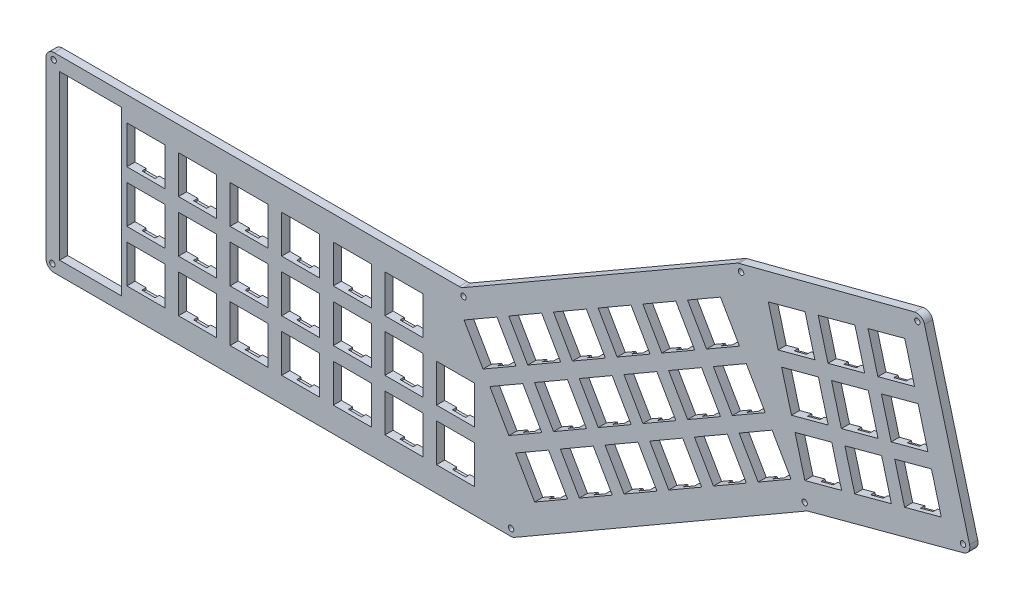
from build123d import *

# Parameters (mm, degrees)
ESQUISSE2_W                           = 14
ESQUISSE2_H                           = 14
BOSS_EXTRU_1_DEPTH                    = 3
ESQUISSE3_W                           = 4.83
ESQUISSE3_H                           = 0.7
ENL_V_MAT_EXTRU_1_DEPTH               = 1.57
R_P_TITION_LIN_AIRE1_COUNT            = 3
R_P_TITION_LIN_AIRE1_PITCH            = 19
R_P_TITION_LIN_AIRE2_COUNT            = 6
R_P_TITION_LIN_AIRE2_PITCH            = 19
R_P_TITION_LIN_AIRE2_COPY_1_SKETCH_W  = 4.83
R_P_TITION_LIN_AIRE2_COPY_1_SKETCH_H  = 0.7
R_P_TITION_LIN_AIRE2_COPY_1_DEPTH     = 1.57
R_P_TITION_LIN_AIRE2_COPY_2_SKETCH_W  = 4.83
R_P_TITION_LIN_AIRE2_COPY_2_SKETCH_H  = 0.7
R_P_TITION_LIN_AIRE2_COPY_2_DEPTH     = 1.57
R_P_TITION_LIN_AIRE2_COPY_3_SKETCH_W  = 4.83
R_P_TITION_LIN_AIRE2_COPY_3_SKETCH_H  = 0.7
R_P_TITION_LIN_AIRE2_COPY_3_DEPTH     = 1.57
R_P_TITION_LIN_AIRE2_COPY_4_SKETCH_W  = 4.83
R_P_TITION_LIN_AIRE2_COPY_4_SKETCH_H  = 0.7
R_P_TITION_LIN_AIRE2_COPY_4_DEPTH     = 1.57
R_P_TITION_LIN_AIRE2_COPY_5_SKETCH_W  = 4.83
R_P_TITION_LIN_AIRE2_COPY_5_SKETCH_H  = 0.7
R_P_TITION_LIN_AIRE2_COPY_5_DEPTH     = 1.57
R_P_TITION_LIN_AIRE2_COPY_6_SKETCH_W  = 4.83
R_P_TITION_LIN_AIRE2_COPY_6_SKETCH_H  = 0.7
R_P_TITION_LIN_AIRE2_COPY_6_DEPTH     = 1.57
R_P_TITION_LIN_AIRE2_COPY_7_SKETCH_W  = 4.83
R_P_TITION_LIN_AIRE2_COPY_7_SKETCH_H  = 0.7
R_P_TITION_LIN_AIRE2_COPY_7_DEPTH     = 1.57
R_P_TITION_LIN_AIRE2_COPY_8_SKETCH_W  = 4.83
R_P_TITION_LIN_AIRE2_COPY_8_SKETCH_H  = 0.7
R_P_TITION_LIN_AIRE2_COPY_8_DEPTH     = 1.57
R_P_TITION_LIN_AIRE2_COPY_9_SKETCH_W  = 4.83
R_P_TITION_LIN_AIRE2_COPY_9_SKETCH_H  = 0.7
R_P_TITION_LIN_AIRE2_COPY_9_DEPTH     = 1.57
R_P_TITION_LIN_AIRE2_COPY_10_SKETCH_W = 4.83
R_P_TITION_LIN_AIRE2_COPY_10_SKETCH_H = 0.7
R_P_TITION_LIN_AIRE2_COPY_10_DEPTH    = 1.57
ESQUISSE4_W                           = 4.83
ESQUISSE4_H                           = 0.7
ENL_V_MAT_EXTRU_2_DEPTH               = 1.57
R_P_TITION_LIN_AIRE3_COUNT            = 2
R_P_TITION_LIN_AIRE3_PITCH            = 19
ENL_V_MAT_EXTRU_3_DEPTH               = 1.57
R_P_TITION_LIN_AIRE4_COUNT            = 3
R_P_TITION_LIN_AIRE4_PITCH            = 19
R_P_TITION_LIN_AIRE5_COUNT            = 6
R_P_TITION_LIN_AIRE5_PITCH            = 19
R_P_TITION_LIN_AIRE5_COPY_1_DEPTH     = 1.57
R_P_TITION_LIN_AIRE5_COPY_2_DEPTH     = 1.57
R_P_TITION_LIN_AIRE5_COPY_3_DEPTH     = 1.57
R_P_TITION_LIN_AIRE5_COPY_4_DEPTH     = 1.57
R_P_TITION_LIN_AIRE5_COPY_5_DEPTH     = 1.57
R_P_TITION_LIN_AIRE5_COPY_6_DEPTH     = 1.57
R_P_TITION_LIN_AIRE5_COPY_7_DEPTH     = 1.57
R_P_TITION_LIN_AIRE5_COPY_8_DEPTH     = 1.57
R_P_TITION_LIN_AIRE5_COPY_9_DEPTH     = 1.57
R_P_TITION_LIN_AIRE5_COPY_10_DEPTH    = 1.57
ENL_V_MAT_EXTRU_4_DEPTH               = 1.57
R_P_TITION_LIN_AIRE6_COUNT            = 3
R_P_TITION_LIN_AIRE6_PITCH            = 19
R_P_TITION_LIN_AIRE7_COUNT            = 3
R_P_TITION_LIN_AIRE7_PITCH            = 19
R_P_TITION_LIN_AIRE7_COPY_1_DEPTH     = 1.57
R_P_TITION_LIN_AIRE7_COPY_2_DEPTH     = 1.57
R_P_TITION_LIN_AIRE7_COPY_3_DEPTH     = 1.57
R_P_TITION_LIN_AIRE7_COPY_4_DEPTH     = 1.57
CONG_2_R                              = 3
ESQUISSE10_R                          = 1
ENL_V_MAT_EXTRU_6_DEPTH               = 10


with BuildPart() as part:
    # Esquisse2 → Boss.-Extru.1 (new body)
    with BuildSketch(Plane.XY):
        Polygon((75.33141454, 71.077500491), (-26.464533767, 12.30154537), (-179.373873722, 12.291034855), (-179.373873722, -50.687645053), (-179.373873722, -57.858487698), (-7.520422715, -57.858487698), (100.854480283, 4.809102496), (161.383942986, 21.020985262), (143.246352653, 88.745859712), align=None)
        with Locations((-142.608757489, -41.687645053)):
            Rectangle(ESQUISSE2_W, ESQUISSE2_H, mode=Mode.SUBTRACT)
        with Locations((-123.608757489, -41.687645053)):
            Rectangle(ESQUISSE2_W, ESQUISSE2_H, mode=Mode.SUBTRACT)
        with Locations((-104.608757489, -41.687645053)):
            Rectangle(ESQUISSE2_W, ESQUISSE2_H, mode=Mode.SUBTRACT)
        Polygon((-151.608757489, 7.292943331), (-151.608757489, 5.312354947), (-151.608757489, -50.858487698), (-151.608757489, -52.858487698), (-174.373873722, -52.858487698), (-174.373873722, 7.291378528), align=None, mode=Mode.SUBTRACT)
        with Locations((-142.608757489, -22.687645053)):
            Rectangle(ESQUISSE2_W, ESQUISSE2_H, mode=Mode.SUBTRACT)
        with Locations((-123.608757489, -22.687645053)):
            Rectangle(ESQUISSE2_W, ESQUISSE2_H, mode=Mode.SUBTRACT)
        with Locations((-104.608757489, -22.687645053)):
            Rectangle(ESQUISSE2_W, ESQUISSE2_H, mode=Mode.SUBTRACT)
        with Locations((-85.608757489, -41.687645053)):
            Rectangle(ESQUISSE2_W, ESQUISSE2_H, mode=Mode.SUBTRACT)
        with Locations((-66.608757489, -41.687645053)):
            Rectangle(ESQUISSE2_W, ESQUISSE2_H, mode=Mode.SUBTRACT)
        with Locations((-47.608757489, -41.687645053)):
            Rectangle(ESQUISSE2_W, ESQUISSE2_H, mode=Mode.SUBTRACT)
        with Locations((-28.608757489, -41.687645053)):
            Rectangle(ESQUISSE2_W, ESQUISSE2_H, mode=Mode.SUBTRACT)
        with Locations((-85.608757489, -22.687645053)):
            Rectangle(ESQUISSE2_W, ESQUISSE2_H, mode=Mode.SUBTRACT)
        with Locations((-66.608757489, -22.687645053)):
            Rectangle(ESQUISSE2_W, ESQUISSE2_H, mode=Mode.SUBTRACT)
        with Locations((-47.608757489, -22.687645053)):
            Rectangle(ESQUISSE2_W, ESQUISSE2_H, mode=Mode.SUBTRACT)
        with Locations((-28.608757489, -22.687645053)):
            Rectangle(ESQUISSE2_W, ESQUISSE2_H, mode=Mode.SUBTRACT)
        with Locations((-142.608757489, -3.687645053)):
            Rectangle(ESQUISSE2_W, ESQUISSE2_H, mode=Mode.SUBTRACT)
        with Locations((-123.608757489, -3.687645053)):
            Rectangle(ESQUISSE2_W, ESQUISSE2_H, mode=Mode.SUBTRACT)
        with Locations((-104.608757489, -3.687645053)):
            Rectangle(ESQUISSE2_W, ESQUISSE2_H, mode=Mode.SUBTRACT)
        with Locations((-85.608757489, -3.687645053)):
            Rectangle(ESQUISSE2_W, ESQUISSE2_H, mode=Mode.SUBTRACT)
        with Locations((-66.608757489, -3.687645053)):
            Rectangle(ESQUISSE2_W, ESQUISSE2_H, mode=Mode.SUBTRACT)
        with Locations((-47.608757489, -3.687645053)):
            Rectangle(ESQUISSE2_W, ESQUISSE2_H, mode=Mode.SUBTRACT)
        Polygon((-25.494741241, 2.507177858), (-13.370385588, 9.507177858), (-6.370385588, -2.617177795), (-18.494741241, -9.617177795), align=None, mode=Mode.SUBTRACT)
        Polygon((-6.494741241, -30.401787486), (5.629614412, -23.401787486), (12.629614412, -35.526143139), (0.505258759, -42.526143139), align=None, mode=Mode.SUBTRACT)
        Polygon((9.959741431, -20.901787486), (22.084097084, -13.901787486), (29.084097084, -26.026143139), (16.959741431, -33.026143139), align=None, mode=Mode.SUBTRACT)
        Polygon((-15.994741241, -13.947304814), (-3.870385588, -6.947304814), (3.129614412, -19.071660467), (-8.994741241, -26.071660467), align=None, mode=Mode.SUBTRACT)
        Polygon((0.459741431, -4.447304814), (12.584097084, 2.552695186), (19.584097084, -9.571660467), (7.459741431, -16.571660467), align=None, mode=Mode.SUBTRACT)
        Polygon((26.414224103, -11.401787486), (38.538579756, -4.401787486), (45.538579756, -16.526143139), (33.414224103, -23.526143139), align=None, mode=Mode.SUBTRACT)
        Polygon((42.868706775, -1.901787486), (54.993062428, 5.098212514), (61.993062428, -7.026143139), (49.868706775, -14.026143139), align=None, mode=Mode.SUBTRACT)
        Polygon((16.914224103, 5.052695186), (29.038579756, 12.052695186), (36.038579756, -0.071660467), (23.914224103, -7.071660467), align=None, mode=Mode.SUBTRACT)
        Polygon((-9.040258569, 12.007177858), (3.084097084, 19.007177858), (10.084097084, 6.882822205), (-2.040258569, -0.117177795), align=None, mode=Mode.SUBTRACT)
        Polygon((59.323189447, 7.598212514), (71.4475451, 14.598212514), (78.4475451, 2.473856861), (66.323189447, -4.526143139), align=None, mode=Mode.SUBTRACT)
        Polygon((33.368706775, 14.552695186), (45.493062428, 21.552695186), (52.493062428, 9.428339533), (40.368706775, 2.428339533), align=None, mode=Mode.SUBTRACT)
        Polygon((75.777672119, 17.098212514), (87.902027772, 24.098212514), (94.902027772, 11.973856861), (82.777672119, 4.973856861), align=None, mode=Mode.SUBTRACT)
        Polygon((7.414224103, 21.507177858), (19.538579756, 28.507177858), (26.538579756, 16.382822205), (14.414224103, 9.382822205), align=None, mode=Mode.SUBTRACT)
        Polygon((23.868706775, 31.007177858), (35.993062428, 38.007177858), (42.993062428, 25.882822205), (30.868706775, 18.882822205), align=None, mode=Mode.SUBTRACT)
        Polygon((49.823189447, 24.052695186), (61.9475451, 31.052695186), (68.9475451, 18.928339533), (56.823189447, 11.928339533), align=None, mode=Mode.SUBTRACT)
        Polygon((66.277672119, 33.552695186), (78.402027772, 40.552695186), (85.402027772, 28.428339533), (73.277672119, 21.428339533), align=None, mode=Mode.SUBTRACT)
        Polygon((40.323189447, 40.507177858), (52.4475451, 47.507177858), (59.4475451, 35.382822205), (47.323189447, 28.382822205), align=None, mode=Mode.SUBTRACT)
        Polygon((56.777672119, 50.007177858), (68.902027772, 57.007177858), (75.902027772, 44.882822205), (63.777672119, 37.882822205), align=None, mode=Mode.SUBTRACT)
        Polygon((99.972171674, 14.073979229), (96.348705043, 27.596940797), (109.871666611, 31.220407428), (113.495133242, 17.69744586), align=None, mode=Mode.SUBTRACT)
        Polygon((118.324762374, 18.991541086), (114.701295742, 32.514502654), (128.22425731, 36.137969285), (131.847723942, 22.615007717), align=None, mode=Mode.SUBTRACT)
        Polygon((136.677353073, 23.909102943), (133.053886442, 37.432064511), (146.57684801, 41.055531142), (150.200314641, 27.532569574), align=None, mode=Mode.SUBTRACT)
        Polygon((95.054609817, 32.426569928), (91.431143186, 45.949531496), (104.954104754, 49.572998128), (108.577571385, 36.05003656), align=None, mode=Mode.SUBTRACT)
        Polygon((113.407200517, 37.344131785), (109.783733885, 50.867093353), (123.306695453, 54.490559985), (126.930162085, 40.967598417), align=None, mode=Mode.SUBTRACT)
        Polygon((131.759791216, 42.261693642), (128.136324585, 55.78465521), (141.659286153, 59.408121842), (145.282752784, 45.885160273), align=None, mode=Mode.SUBTRACT)
        Polygon((90.13704796, 50.779160628), (86.513581329, 64.302122196), (100.036542897, 67.925588827), (103.660009528, 54.402627259), align=None, mode=Mode.SUBTRACT)
        Polygon((108.48963866, 55.696722485), (104.866172028, 69.219684053), (118.389133596, 72.843150684), (122.012600228, 59.320189116), align=None, mode=Mode.SUBTRACT)
        Polygon((126.842229359, 60.614284342), (123.218762728, 74.13724591), (136.741724296, 77.760712541), (140.365190927, 64.237750973), align=None, mode=Mode.SUBTRACT)
    extrude(amount=BOSS_EXTRU_1_DEPTH)

    # Esquisse3 → Enlèv. mat.-Extru.1 (cut)
    with BuildSketch(Plane(origin=(0, 0, 0), x_dir=(-1, 0, 0), z_dir=(0, 0, -1))):
        with Locations((143.081022506, 3.662354947)):
            Rectangle(ESQUISSE3_W, ESQUISSE3_H)
        with Locations((143.081022506, -11.037645053)):
            Rectangle(ESQUISSE3_W, ESQUISSE3_H)
    enl_v_mat_extru_1 = extrude(amount=-ENL_V_MAT_EXTRU_1_DEPTH, mode=Mode.SUBTRACT)

    # Répétition linéaire1: Enlèv. mat.-Extru.1 ×3
    with Locations(*[(0, -i * R_P_TITION_LIN_AIRE1_PITCH, 0) for i in range(1, R_P_TITION_LIN_AIRE1_COUNT)]):
        add(enl_v_mat_extru_1, mode=Mode.SUBTRACT)

    # Répétition linéaire2: Enlèv. mat.-Extru.1 ×6
    with Locations(*[(i * R_P_TITION_LIN_AIRE2_PITCH, 0, 0) for i in range(1, R_P_TITION_LIN_AIRE2_COUNT)]):
        add(enl_v_mat_extru_1, mode=Mode.SUBTRACT)

    # Répétition linéaire2 copy 1 sketch → Répétition linéaire2 copy 1 (cut)
    with BuildSketch(Plane(origin=(19, -19, 0), x_dir=(-1, 0, 0), z_dir=(0, 0, -1))):
        with Locations((143.081022506, 3.662354947)):
            Rectangle(R_P_TITION_LIN_AIRE2_COPY_1_SKETCH_W, R_P_TITION_LIN_AIRE2_COPY_1_SKETCH_H)
        with Locations((143.081022506, -11.037645053)):
            Rectangle(R_P_TITION_LIN_AIRE2_COPY_1_SKETCH_W, R_P_TITION_LIN_AIRE2_COPY_1_SKETCH_H)
    extrude(amount=-R_P_TITION_LIN_AIRE2_COPY_1_DEPTH, mode=Mode.SUBTRACT)

    # Répétition linéaire2 copy 2 sketch → Répétition linéaire2 copy 2 (cut)
    with BuildSketch(Plane(origin=(38, -19, 0), x_dir=(-1, 0, 0), z_dir=(0, 0, -1))):
        with Locations((143.081022506, 3.662354947)):
            Rectangle(R_P_TITION_LIN_AIRE2_COPY_2_SKETCH_W, R_P_TITION_LIN_AIRE2_COPY_2_SKETCH_H)
        with Locations((143.081022506, -11.037645053)):
            Rectangle(R_P_TITION_LIN_AIRE2_COPY_2_SKETCH_W, R_P_TITION_LIN_AIRE2_COPY_2_SKETCH_H)
    extrude(amount=-R_P_TITION_LIN_AIRE2_COPY_2_DEPTH, mode=Mode.SUBTRACT)

    # Répétition linéaire2 copy 3 sketch → Répétition linéaire2 copy 3 (cut)
    with BuildSketch(Plane(origin=(57, -19, 0), x_dir=(-1, 0, 0), z_dir=(0, 0, -1))):
        with Locations((143.081022506, 3.662354947)):
            Rectangle(R_P_TITION_LIN_AIRE2_COPY_3_SKETCH_W, R_P_TITION_LIN_AIRE2_COPY_3_SKETCH_H)
        with Locations((143.081022506, -11.037645053)):
            Rectangle(R_P_TITION_LIN_AIRE2_COPY_3_SKETCH_W, R_P_TITION_LIN_AIRE2_COPY_3_SKETCH_H)
    extrude(amount=-R_P_TITION_LIN_AIRE2_COPY_3_DEPTH, mode=Mode.SUBTRACT)

    # Répétition linéaire2 copy 4 sketch → Répétition linéaire2 copy 4 (cut)
    with BuildSketch(Plane(origin=(76, -19, 0), x_dir=(-1, 0, 0), z_dir=(0, 0, -1))):
        with Locations((143.081022506, 3.662354947)):
            Rectangle(R_P_TITION_LIN_AIRE2_COPY_4_SKETCH_W, R_P_TITION_LIN_AIRE2_COPY_4_SKETCH_H)
        with Locations((143.081022506, -11.037645053)):
            Rectangle(R_P_TITION_LIN_AIRE2_COPY_4_SKETCH_W, R_P_TITION_LIN_AIRE2_COPY_4_SKETCH_H)
    extrude(amount=-R_P_TITION_LIN_AIRE2_COPY_4_DEPTH, mode=Mode.SUBTRACT)

    # Répétition linéaire2 copy 5 sketch → Répétition linéaire2 copy 5 (cut)
    with BuildSketch(Plane(origin=(95, -19, 0), x_dir=(-1, 0, 0), z_dir=(0, 0, -1))):
        with Locations((143.081022506, 3.662354947)):
            Rectangle(R_P_TITION_LIN_AIRE2_COPY_5_SKETCH_W, R_P_TITION_LIN_AIRE2_COPY_5_SKETCH_H)
        with Locations((143.081022506, -11.037645053)):
            Rectangle(R_P_TITION_LIN_AIRE2_COPY_5_SKETCH_W, R_P_TITION_LIN_AIRE2_COPY_5_SKETCH_H)
    extrude(amount=-R_P_TITION_LIN_AIRE2_COPY_5_DEPTH, mode=Mode.SUBTRACT)

    # Répétition linéaire2 copy 6 sketch → Répétition linéaire2 copy 6 (cut)
    with BuildSketch(Plane(origin=(19, -38, 0), x_dir=(-1, 0, 0), z_dir=(0, 0, -1))):
        with Locations((143.081022506, 3.662354947)):
            Rectangle(R_P_TITION_LIN_AIRE2_COPY_6_SKETCH_W, R_P_TITION_LIN_AIRE2_COPY_6_SKETCH_H)
        with Locations((143.081022506, -11.037645053)):
            Rectangle(R_P_TITION_LIN_AIRE2_COPY_6_SKETCH_W, R_P_TITION_LIN_AIRE2_COPY_6_SKETCH_H)
    extrude(amount=-R_P_TITION_LIN_AIRE2_COPY_6_DEPTH, mode=Mode.SUBTRACT)

    # Répétition linéaire2 copy 7 sketch → Répétition linéaire2 copy 7 (cut)
    with BuildSketch(Plane(origin=(38, -38, 0), x_dir=(-1, 0, 0), z_dir=(0, 0, -1))):
        with Locations((143.081022506, 3.662354947)):
            Rectangle(R_P_TITION_LIN_AIRE2_COPY_7_SKETCH_W, R_P_TITION_LIN_AIRE2_COPY_7_SKETCH_H)
        with Locations((143.081022506, -11.037645053)):
            Rectangle(R_P_TITION_LIN_AIRE2_COPY_7_SKETCH_W, R_P_TITION_LIN_AIRE2_COPY_7_SKETCH_H)
    extrude(amount=-R_P_TITION_LIN_AIRE2_COPY_7_DEPTH, mode=Mode.SUBTRACT)

    # Répétition linéaire2 copy 8 sketch → Répétition linéaire2 copy 8 (cut)
    with BuildSketch(Plane(origin=(57, -38, 0), x_dir=(-1, 0, 0), z_dir=(0, 0, -1))):
        with Locations((143.081022506, 3.662354947)):
            Rectangle(R_P_TITION_LIN_AIRE2_COPY_8_SKETCH_W, R_P_TITION_LIN_AIRE2_COPY_8_SKETCH_H)
        with Locations((143.081022506, -11.037645053)):
            Rectangle(R_P_TITION_LIN_AIRE2_COPY_8_SKETCH_W, R_P_TITION_LIN_AIRE2_COPY_8_SKETCH_H)
    extrude(amount=-R_P_TITION_LIN_AIRE2_COPY_8_DEPTH, mode=Mode.SUBTRACT)

    # Répétition linéaire2 copy 9 sketch → Répétition linéaire2 copy 9 (cut)
    with BuildSketch(Plane(origin=(76, -38, 0), x_dir=(-1, 0, 0), z_dir=(0, 0, -1))):
        with Locations((143.081022506, 3.662354947)):
            Rectangle(R_P_TITION_LIN_AIRE2_COPY_9_SKETCH_W, R_P_TITION_LIN_AIRE2_COPY_9_SKETCH_H)
        with Locations((143.081022506, -11.037645053)):
            Rectangle(R_P_TITION_LIN_AIRE2_COPY_9_SKETCH_W, R_P_TITION_LIN_AIRE2_COPY_9_SKETCH_H)
    extrude(amount=-R_P_TITION_LIN_AIRE2_COPY_9_DEPTH, mode=Mode.SUBTRACT)

    # Répétition linéaire2 copy 10 sketch → Répétition linéaire2 copy 10 (cut)
    with BuildSketch(Plane(origin=(95, -38, 0), x_dir=(-1, 0, 0), z_dir=(0, 0, -1))):
        with Locations((143.081022506, 3.662354947)):
            Rectangle(R_P_TITION_LIN_AIRE2_COPY_10_SKETCH_W, R_P_TITION_LIN_AIRE2_COPY_10_SKETCH_H)
        with Locations((143.081022506, -11.037645053)):
            Rectangle(R_P_TITION_LIN_AIRE2_COPY_10_SKETCH_W, R_P_TITION_LIN_AIRE2_COPY_10_SKETCH_H)
    extrude(amount=-R_P_TITION_LIN_AIRE2_COPY_10_DEPTH, mode=Mode.SUBTRACT)

    # Esquisse4 → Enlèv. mat.-Extru.2 (cut)
    with BuildSketch(Plane(origin=(0, 0, 0), x_dir=(-1, 0, 0), z_dir=(0, 0, -1))):
        with Locations((28.76106948, -15.337645053)):
            Rectangle(ESQUISSE4_W, ESQUISSE4_H)
        with Locations((28.76106948, -30.037645053)):
            Rectangle(ESQUISSE4_W, ESQUISSE4_H)
    enl_v_mat_extru_2 = extrude(amount=-ENL_V_MAT_EXTRU_2_DEPTH, mode=Mode.SUBTRACT)

    # Répétition linéaire3: Enlèv. mat.-Extru.2 ×2
    with Locations(*[(0, -i * R_P_TITION_LIN_AIRE3_PITCH, 0) for i in range(1, R_P_TITION_LIN_AIRE3_COUNT)]):
        add(enl_v_mat_extru_2, mode=Mode.SUBTRACT)

    # Esquisse6 → Enlèv. mat.-Extru.3 (cut)
    with BuildSketch(Plane(origin=(0, 0, 0), x_dir=(-1, 0, 0), z_dir=(0, 0, -1))):
        Polygon((17.330819297, 7.22062039), (21.513721997, 4.80562039), (21.863602937, 5.411631954), (17.680700237, 7.826631954), align=None)
        Polygon((10.330819297, -4.903735263), (14.513721997, -7.318735263), (14.163841058, -7.924746828), (9.980938357, -5.509746828), align=None)
    enl_v_mat_extru_3 = extrude(amount=-ENL_V_MAT_EXTRU_3_DEPTH, mode=Mode.SUBTRACT)

    # Répétition linéaire4: Enlèv. mat.-Extru.3 ×3
    with Locations(*[Vector(0.4999999999994475, -0.8660254037847577, 0) * (i * R_P_TITION_LIN_AIRE4_PITCH) for i in range(1, R_P_TITION_LIN_AIRE4_COUNT)]):
        add(enl_v_mat_extru_3, mode=Mode.SUBTRACT)

    # Répétition linéaire5: Enlèv. mat.-Extru.3 ×6
    with Locations(*[Vector(0.8660254037829719, 0.5000000000025406, 0) * (i * R_P_TITION_LIN_AIRE5_PITCH) for i in range(1, R_P_TITION_LIN_AIRE5_COUNT)]):
        add(enl_v_mat_extru_3, mode=Mode.SUBTRACT)

    # Répétition linéaire5 copy 1 sketch → Répétition linéaire5 copy 1 (cut)
    with BuildSketch(Plane(origin=(25.954482672, -6.954482672, 0), x_dir=(-1, 0, 0), z_dir=(0, 0, -1))):
        Polygon((17.330819297, 7.22062039), (21.513721997, 4.80562039), (21.863602937, 5.411631954), (17.680700237, 7.826631954), align=None)
        Polygon((10.330819297, -4.903735263), (14.513721997, -7.318735263), (14.163841058, -7.924746828), (9.980938357, -5.509746828), align=None)
    extrude(amount=-R_P_TITION_LIN_AIRE5_COPY_1_DEPTH, mode=Mode.SUBTRACT)

    # Répétition linéaire5 copy 2 sketch → Répétition linéaire5 copy 2 (cut)
    with BuildSketch(Plane(origin=(42.408965344, 2.545517328, 0), x_dir=(-1, 0, 0), z_dir=(0, 0, -1))):
        Polygon((17.330819297, 7.22062039), (21.513721997, 4.80562039), (21.863602937, 5.411631954), (17.680700237, 7.826631954), align=None)
        Polygon((10.330819297, -4.903735263), (14.513721997, -7.318735263), (14.163841058, -7.924746828), (9.980938357, -5.509746828), align=None)
    extrude(amount=-R_P_TITION_LIN_AIRE5_COPY_2_DEPTH, mode=Mode.SUBTRACT)

    # Répétition linéaire5 copy 3 sketch → Répétition linéaire5 copy 3 (cut)
    with BuildSketch(Plane(origin=(58.863448016, 12.045517328, 0), x_dir=(-1, 0, 0), z_dir=(0, 0, -1))):
        Polygon((17.330819297, 7.22062039), (21.513721997, 4.80562039), (21.863602937, 5.411631954), (17.680700237, 7.826631954), align=None)
        Polygon((10.330819297, -4.903735263), (14.513721997, -7.318735263), (14.163841058, -7.924746828), (9.980938357, -5.509746828), align=None)
    extrude(amount=-R_P_TITION_LIN_AIRE5_COPY_3_DEPTH, mode=Mode.SUBTRACT)

    # Répétition linéaire5 copy 4 sketch → Répétition linéaire5 copy 4 (cut)
    with BuildSketch(Plane(origin=(75.317930687, 21.545517328, 0), x_dir=(-1, 0, 0), z_dir=(0, 0, -1))):
        Polygon((17.330819297, 7.22062039), (21.513721997, 4.80562039), (21.863602937, 5.411631954), (17.680700237, 7.826631954), align=None)
        Polygon((10.330819297, -4.903735263), (14.513721997, -7.318735263), (14.163841058, -7.924746828), (9.980938357, -5.509746828), align=None)
    extrude(amount=-R_P_TITION_LIN_AIRE5_COPY_4_DEPTH, mode=Mode.SUBTRACT)

    # Répétition linéaire5 copy 5 sketch → Répétition linéaire5 copy 5 (cut)
    with BuildSketch(Plane(origin=(91.772413359, 31.045517328, 0), x_dir=(-1, 0, 0), z_dir=(0, 0, -1))):
        Polygon((17.330819297, 7.22062039), (21.513721997, 4.80562039), (21.863602937, 5.411631954), (17.680700237, 7.826631954), align=None)
        Polygon((10.330819297, -4.903735263), (14.513721997, -7.318735263), (14.163841058, -7.924746828), (9.980938357, -5.509746828), align=None)
    extrude(amount=-R_P_TITION_LIN_AIRE5_COPY_5_DEPTH, mode=Mode.SUBTRACT)

    # Répétition linéaire5 copy 6 sketch → Répétition linéaire5 copy 6 (cut)
    with BuildSketch(Plane(origin=(35.454482672, -23.408965344, 0), x_dir=(-1, 0, 0), z_dir=(0, 0, -1))):
        Polygon((17.330819297, 7.22062039), (21.513721997, 4.80562039), (21.863602937, 5.411631954), (17.680700237, 7.826631954), align=None)
        Polygon((10.330819297, -4.903735263), (14.513721997, -7.318735263), (14.163841058, -7.924746828), (9.980938357, -5.509746828), align=None)
    extrude(amount=-R_P_TITION_LIN_AIRE5_COPY_6_DEPTH, mode=Mode.SUBTRACT)

    # Répétition linéaire5 copy 7 sketch → Répétition linéaire5 copy 7 (cut)
    with BuildSketch(Plane(origin=(51.908965344, -13.908965344, 0), x_dir=(-1, 0, 0), z_dir=(0, 0, -1))):
        Polygon((17.330819297, 7.22062039), (21.513721997, 4.80562039), (21.863602937, 5.411631954), (17.680700237, 7.826631954), align=None)
        Polygon((10.330819297, -4.903735263), (14.513721997, -7.318735263), (14.163841058, -7.924746828), (9.980938357, -5.509746828), align=None)
    extrude(amount=-R_P_TITION_LIN_AIRE5_COPY_7_DEPTH, mode=Mode.SUBTRACT)

    # Répétition linéaire5 copy 8 sketch → Répétition linéaire5 copy 8 (cut)
    with BuildSketch(Plane(origin=(68.363448016, -4.408965344, 0), x_dir=(-1, 0, 0), z_dir=(0, 0, -1))):
        Polygon((17.330819297, 7.22062039), (21.513721997, 4.80562039), (21.863602937, 5.411631954), (17.680700237, 7.826631954), align=None)
        Polygon((10.330819297, -4.903735263), (14.513721997, -7.318735263), (14.163841058, -7.924746828), (9.980938357, -5.509746828), align=None)
    extrude(amount=-R_P_TITION_LIN_AIRE5_COPY_8_DEPTH, mode=Mode.SUBTRACT)

    # Répétition linéaire5 copy 9 sketch → Répétition linéaire5 copy 9 (cut)
    with BuildSketch(Plane(origin=(84.817930687, 5.091034656, 0), x_dir=(-1, 0, 0), z_dir=(0, 0, -1))):
        Polygon((17.330819297, 7.22062039), (21.513721997, 4.80562039), (21.863602937, 5.411631954), (17.680700237, 7.826631954), align=None)
        Polygon((10.330819297, -4.903735263), (14.513721997, -7.318735263), (14.163841058, -7.924746828), (9.980938357, -5.509746828), align=None)
    extrude(amount=-R_P_TITION_LIN_AIRE5_COPY_9_DEPTH, mode=Mode.SUBTRACT)

    # Répétition linéaire5 copy 10 sketch → Répétition linéaire5 copy 10 (cut)
    with BuildSketch(Plane(origin=(101.272413359, 14.591034656, 0), x_dir=(-1, 0, 0), z_dir=(0, 0, -1))):
        Polygon((17.330819297, 7.22062039), (21.513721997, 4.80562039), (21.863602937, 5.411631954), (17.680700237, 7.826631954), align=None)
        Polygon((10.330819297, -4.903735263), (14.513721997, -7.318735263), (14.163841058, -7.924746828), (9.980938357, -5.509746828), align=None)
    extrude(amount=-R_P_TITION_LIN_AIRE5_COPY_10_DEPTH, mode=Mode.SUBTRACT)

    # Esquisse7 → Enlèv. mat.-Extru.4 (cut)
    with BuildSketch(Plane(origin=(0, 0, 0), x_dir=(-1, 0, 0), z_dir=(0, 0, -1))):
        Polygon((-95.590942143, 66.734393695), (-90.959182082, 65.493317328), (-90.774300447, 66.183304984), (-95.406060508, 67.424381352), align=None)
        Polygon((-94.582648714, 51.97035576), (-94.767530349, 51.280368103), (-99.39929041, 52.521444471), (-99.214408775, 53.211432127), align=None)
    enl_v_mat_extru_4 = extrude(amount=-ENL_V_MAT_EXTRU_4_DEPTH, mode=Mode.SUBTRACT)

    # Répétition linéaire6: Enlèv. mat.-Extru.4 ×3
    with Locations(*[Vector(0.2588190450992223, -0.9659258262899522, 0) * (i * R_P_TITION_LIN_AIRE6_PITCH) for i in range(1, R_P_TITION_LIN_AIRE6_COUNT)]):
        add(enl_v_mat_extru_4, mode=Mode.SUBTRACT)

    # Répétition linéaire7: Enlèv. mat.-Extru.4 ×3
    with Locations(*[Vector(0.9659258262899522, 0.25881904509922216, 0) * (i * R_P_TITION_LIN_AIRE7_PITCH) for i in range(1, R_P_TITION_LIN_AIRE7_COUNT)]):
        add(enl_v_mat_extru_4, mode=Mode.SUBTRACT)

    # Répétition linéaire7 copy 1 sketch → Répétition linéaire7 copy 1 (cut)
    with BuildSketch(Plane(origin=(23.270152556, -13.435028843, 0), x_dir=(-1, 0, 0), z_dir=(0, 0, -1))):
        Polygon((-95.590942143, 66.734393695), (-90.959182082, 65.493317328), (-90.774300447, 66.183304984), (-95.406060508, 67.424381352), align=None)
        Polygon((-94.582648714, 51.97035576), (-94.767530349, 51.280368103), (-99.39929041, 52.521444471), (-99.214408775, 53.211432127), align=None)
    extrude(amount=-R_P_TITION_LIN_AIRE7_COPY_1_DEPTH, mode=Mode.SUBTRACT)

    # Répétition linéaire7 copy 2 sketch → Répétition linéaire7 copy 2 (cut)
    with BuildSketch(Plane(origin=(41.622743256, -8.517466986, 0), x_dir=(-1, 0, 0), z_dir=(0, 0, -1))):
        Polygon((-95.590942143, 66.734393695), (-90.959182082, 65.493317328), (-90.774300447, 66.183304984), (-95.406060508, 67.424381352), align=None)
        Polygon((-94.582648714, 51.97035576), (-94.767530349, 51.280368103), (-99.39929041, 52.521444471), (-99.214408775, 53.211432127), align=None)
    extrude(amount=-R_P_TITION_LIN_AIRE7_COPY_2_DEPTH, mode=Mode.SUBTRACT)

    # Répétition linéaire7 copy 3 sketch → Répétition linéaire7 copy 3 (cut)
    with BuildSketch(Plane(origin=(28.187714413, -31.787619542, 0), x_dir=(-1, 0, 0), z_dir=(0, 0, -1))):
        Polygon((-95.590942143, 66.734393695), (-90.959182082, 65.493317328), (-90.774300447, 66.183304984), (-95.406060508, 67.424381352), align=None)
        Polygon((-94.582648714, 51.97035576), (-94.767530349, 51.280368103), (-99.39929041, 52.521444471), (-99.214408775, 53.211432127), align=None)
    extrude(amount=-R_P_TITION_LIN_AIRE7_COPY_3_DEPTH, mode=Mode.SUBTRACT)

    # Répétition linéaire7 copy 4 sketch → Répétition linéaire7 copy 4 (cut)
    with BuildSketch(Plane(origin=(46.540305113, -26.870057685, 0), x_dir=(-1, 0, 0), z_dir=(0, 0, -1))):
        Polygon((-95.590942143, 66.734393695), (-90.959182082, 65.493317328), (-90.774300447, 66.183304984), (-95.406060508, 67.424381352), align=None)
        Polygon((-94.582648714, 51.97035576), (-94.767530349, 51.280368103), (-99.39929041, 52.521444471), (-99.214408775, 53.211432127), align=None)
    extrude(amount=-R_P_TITION_LIN_AIRE7_COPY_4_DEPTH, mode=Mode.SUBTRACT)

    # Congé2
    cong_2_edges = [part.edges().sort_by_distance(p)[0] for p in [
        (75.33141454, 71.077500491, 1.5),
        (-26.464533767, 12.30154537, 1.5),
        (-179.373873722, 12.291034855, 1.5),
        (-179.373873722, -57.858487698, 1.5),
        (-7.520422715, -57.858487698, 1.5),
        (100.854480283, 4.809102496, 1.5),
        (161.383942986, 21.020985262, 1.5),
        (143.246352653, 88.745859712, 1.5),
    ]]
    fillet(cong_2_edges, radius=CONG_2_R)

    # Esquisse10 → Enlèv. mat.-Extru.6 (cut)
    with BuildSketch(Plane.XY.offset(3)):
        with Locations((158.201617013, 22.958080812)):
            Circle(ESQUISSE10_R)
        with Locations((141.388472611, 85.534334234)):
            Circle(ESQUISSE10_R)
        with Locations((76.500226548, 68.776582274)):
            Circle(ESQUISSE10_R)
        with Locations((99.890442316, 7.071415488)):
            Circle(ESQUISSE10_R)
        with Locations((-8.172352823, -55.275906246)):
            Circle(ESQUISSE10_R)
        with Locations((-25.691359515, 9.920090126)):
            Circle(ESQUISSE10_R)
        with Locations((-176.562127678, 9.920090126)):
            Circle(ESQUISSE10_R)
        with Locations((-177.029598341, -55.275906246)):
            Circle(ESQUISSE10_R)
    extrude(amount=-ENL_V_MAT_EXTRU_6_DEPTH, mode=Mode.SUBTRACT)


solid = part.part
